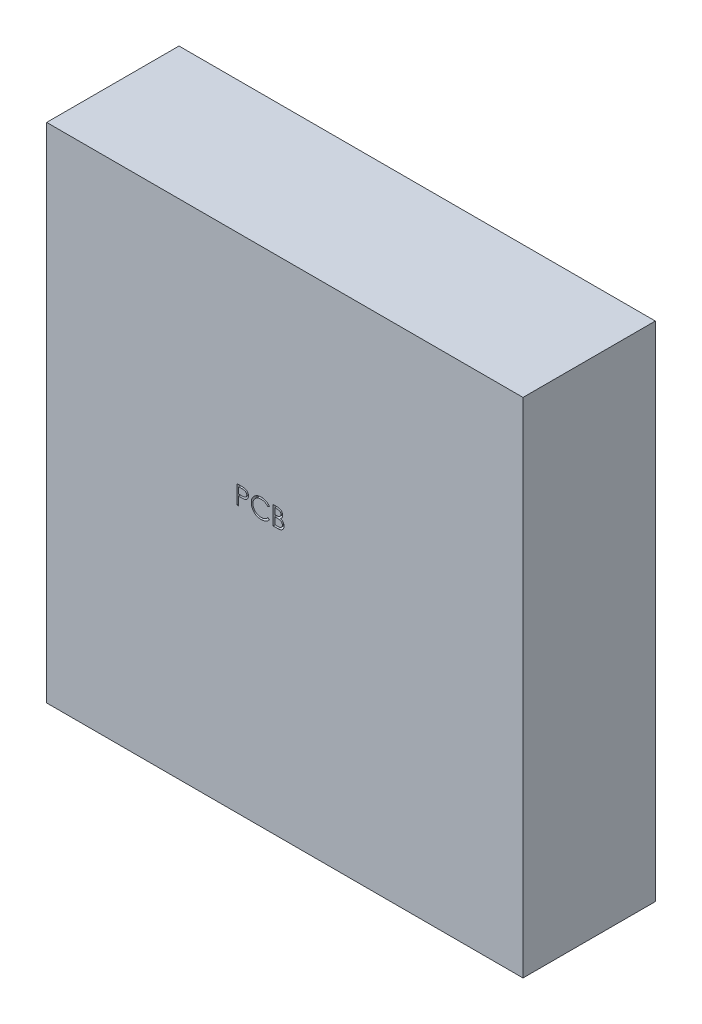
from build123d import *

# Parameters (mm, degrees)
SKETCH1_W           = 90
SKETCH1_H           = 25
BOSS_EXTRUDE1_DEPTH = 95
BOSS_EXTRUDE2_START = -1
BOSS_EXTRUDE2_DEPTH = 1


# Read off the part's stored shape, not the designer's step: Boss-Extrude2
with BuildPart() as part:
    # Sketch1 → Boss-Extrude1 (new body)
    with BuildSketch(Plane(origin=(0, 0, 0), x_dir=(1, 0, 0), z_dir=(0, 1, 0))):
        with Locations((15.273547721, 2.732737108)):
            Rectangle(SKETCH1_W, SKETCH1_H)
    extrude(amount=BOSS_EXTRUDE1_DEPTH)

    # Boss-Extrude2 outline → Boss-Extrude2 (cut)
    # profile 1 of 3: a face of its own
    with BuildSketch(Plane.XY.offset(9.767262892).offset(BOSS_EXTRUDE2_START)):
        with BuildLine():
            add(Edge.make_bspline(
                [(13.74484957, 53.868745646), (13.778278048, 53.868569896), (13.843070759, 53.868229248), (13.9372902, 53.862946117), (14.025539011, 53.855742447), (14.107842783, 53.844312354), (14.184163486, 53.830520577), (14.254731123, 53.813818761), (14.319321295, 53.793792147), (14.396434032, 53.761945866), (14.484354693, 53.714622698), (14.579553085, 53.644694133), (14.660957325, 53.559161669), (14.731143642, 53.462679014), (14.786944761, 53.356543242), (14.827314059, 53.243284053), (14.852871934, 53.124362312), (14.855500368, 53.042719134), (14.856828737, 53.001457986)],
                knots=[0, 0, 0, 0, 0.062594097, 0.121322939, 0.176680142, 0.228365096, 0.276868446, 0.321879128, 0.364098625, 0.403355696, 0.477967948, 0.550535461, 0.623584457, 0.698174882, 0.77335367, 0.847281125, 0.92281834, 1, 1, 1, 1], degree=3))
            Line((13.74484957, 53.868745646), (13.061956942, 53.868745646))
            Line((13.061956942, 53.868745646), (13.061956942, 50.368745646))
            Line((13.061956942, 50.368745646), (14.008471365, 50.368745646))
            add(Edge.make_bspline(
                [(15.126059506, 51.36223523), (15.12508266, 51.328068357), (15.123160688, 51.260844079), (15.108980716, 51.162088945), (15.084971609, 51.067713998), (15.051900463, 50.977108815), (15.008738148, 50.890448681), (14.956210184, 50.807635417), (14.89357862, 50.729501086), (14.823515751, 50.655177463), (14.744253606, 50.588349676), (14.658737851, 50.528833969), (14.565891531, 50.479887907), (14.467239537, 50.438771886), (14.361675221, 50.407364687), (14.249672614, 50.385392113), (14.131328312, 50.370587076), (14.050118561, 50.369369871), (14.008471365, 50.368745646)],
                knots=[0, 0, 0, 0, 0.061160277, 0.120334558, 0.178180255, 0.235235126, 0.292682961, 0.351186248, 0.41045661, 0.471719854, 0.533761203, 0.595739024, 0.657887515, 0.72129518, 0.786822515, 0.854686154, 0.925477986, 1, 1, 1, 1], degree=3))
            add(Edge.make_bspline(
                [(14.452281461, 52.25686664), (14.492041889, 52.241601641), (14.568113436, 52.212395916), (14.672799448, 52.160760452), (14.762994293, 52.104598342), (14.839391439, 52.043266492), (14.904729094, 51.977157681), (14.961782036, 51.905302567), (15.01046341, 51.826763809), (15.052176334, 51.742360274), (15.08472509, 51.652953805), (15.109100994, 51.559383029), (15.123068443, 51.461983474), (15.125056084, 51.395698095), (15.126059506, 51.36223523)],
                knots=[0, 0, 0, 0, 0.106057493, 0.202914257, 0.290300165, 0.370222566, 0.446383721, 0.5213969, 0.598291083, 0.676142469, 0.7555287, 0.834887172, 0.916646049, 1, 1, 1, 1], degree=3))
            add(Edge.make_bspline(
                [(14.856828737, 53.001457986), (14.855735518, 52.96280543), (14.853587241, 52.886849513), (14.833044482, 52.775755404), (14.800883813, 52.670004185), (14.756178564, 52.5699818), (14.698076568, 52.477948187), (14.629218249, 52.393160921), (14.546141447, 52.319209864), (14.483898207, 52.277866961), (14.452281461, 52.25686664)],
                knots=[0, 0, 0, 0, 0.130569107, 0.256580609, 0.380551617, 0.503622917, 0.625739323, 0.747548582, 0.871766119, 1, 1, 1, 1], degree=3))
        make_face()
        with BuildLine():
            add(Edge.make_bspline(
                [(14.239140435, 51.987635871), (14.22211134, 51.991090955), (14.185188747, 51.998582289), (14.124981167, 52.006489993), (14.056245298, 52.013535053), (13.978822421, 52.01874621), (13.89261458, 52.024132754), (13.797437661, 52.026227575), (13.693680346, 52.028726835), (13.621687974, 52.028907969), (13.584292679, 52.029002056)],
                knots=[0, 0, 0, 0, 0.079306486, 0.171952819, 0.277056507, 0.394730576, 0.526177321, 0.671344767, 0.829285257, 1, 1, 1, 1], degree=3))
            add(Edge.make_bspline(
                [(14.811956942, 51.36223523), (14.811680837, 51.38072857), (14.811133082, 51.417416952), (14.802872467, 51.471332771), (14.790858598, 51.523558644), (14.775327164, 51.574236385), (14.752707697, 51.622449761), (14.726301152, 51.669152321), (14.69533975, 51.7144058), (14.647095584, 51.771618054), (14.5769236, 51.837535066), (14.477216824, 51.902072569), (14.363844526, 51.954120376), (14.281617033, 51.976219852), (14.239140435, 51.987635871)],
                knots=[0, 0, 0, 0, 0.060287398, 0.119602355, 0.177503371, 0.235142664, 0.292132593, 0.350871209, 0.410097863, 0.470731522, 0.594828704, 0.722578824, 0.85669139, 1, 1, 1, 1], degree=3))
            add(Edge.make_bspline(
                [(13.823375211, 50.727720005), (13.855394137, 50.728103753), (13.917106396, 50.728843375), (14.006207626, 50.73125793), (14.088790729, 50.736750205), (14.164478865, 50.745396055), (14.234089318, 50.754774504), (14.296787021, 50.767385785), (14.353080214, 50.781834746), (14.418354522, 50.804168918), (14.49185803, 50.838865389), (14.571068887, 50.891179615), (14.641495105, 50.953502923), (14.701300364, 51.025633837), (14.750313353, 51.104065164), (14.785968808, 51.187210514), (14.807959664, 51.273696041), (14.810621834, 51.332662754), (14.811956942, 51.36223523)],
                knots=[0, 0, 0, 0, 0.072502489, 0.139738989, 0.201795135, 0.259821934, 0.312205989, 0.360773434, 0.404540343, 0.443698099, 0.516840794, 0.587874336, 0.657965418, 0.728969389, 0.79930772, 0.866635778, 0.933116329, 1, 1, 1, 1], degree=3))
            Line((13.823375211, 50.727720005), (13.376059506, 50.727720005))
            Line((13.376059506, 50.727720005), (13.376059506, 52.029002056))
            Line((13.376059506, 52.029002056), (13.584292679, 52.029002056))
        make_face(mode=Mode.SUBTRACT)
        with BuildLine():
            add(Edge.make_bspline(
                [(14.542726173, 52.99514789), (14.542199992, 53.014573661), (14.541167833, 53.052679433), (14.53271453, 53.108228788), (14.518346955, 53.16047254), (14.499892662, 53.21012665), (14.474103974, 53.255638501), (14.44374051, 53.298581696), (14.40705482, 53.337493815), (14.365297507, 53.373863313), (14.317288884, 53.406107841), (14.263057593, 53.434348604), (14.201869916, 53.457089381), (14.134757061, 53.477005533), (14.060685973, 53.490993827), (13.98051142, 53.502647215), (13.893576701, 53.508579957), (13.833431598, 53.50936532), (13.802341557, 53.509771287)],
                knots=[0, 0, 0, 0, 0.057003133, 0.111817869, 0.164402372, 0.215869805, 0.26684111, 0.317478963, 0.369902136, 0.423400449, 0.479718398, 0.539241497, 0.602430689, 0.671029546, 0.744484798, 0.823453971, 0.908740313, 1, 1, 1, 1], degree=3))
            add(Edge.make_bspline(
                [(13.587097166, 52.387976415), (13.617945962, 52.388376338), (13.677552121, 52.389149071), (13.763872017, 52.391362588), (13.843997036, 52.397560632), (13.917788869, 52.403756894), (13.985131313, 52.413831481), (14.045875174, 52.425823604), (14.100973771, 52.438506509), (14.164513317, 52.460075996), (14.236586265, 52.491953671), (14.313419369, 52.541425508), (14.381153839, 52.600349861), (14.438351026, 52.668340823), (14.485162497, 52.743207008), (14.517676212, 52.823753889), (14.539723496, 52.907974021), (14.541715028, 52.965792274), (14.542726173, 52.99514789)],
                knots=[0, 0, 0, 0, 0.072301034, 0.139700332, 0.202288511, 0.260599533, 0.313190329, 0.361738933, 0.405706476, 0.445539985, 0.518831956, 0.58977824, 0.658867479, 0.728430478, 0.797282704, 0.864815377, 0.931363753, 1, 1, 1, 1], degree=3))
            Line((13.587097166, 52.387976415), (13.376059506, 52.387976415))
            Line((13.376059506, 52.387976415), (13.376059506, 53.509771287))
            Line((13.376059506, 53.509771287), (13.802341557, 53.509771287))
        make_face(mode=Mode.SUBTRACT)
    # profile 2 of 3: a face of its own
    with BuildSketch(Plane.XY.offset(9.767262892).offset(BOSS_EXTRUDE2_START)):
        with BuildLine():
            add(Edge.make_bspline(
                [(10.816964955, 53.958489236), (10.857179427, 53.958007098), (10.936779924, 53.957052754), (11.054532576, 53.947746612), (11.169174903, 53.932233005), (11.280785885, 53.911116936), (11.389908501, 53.884909614), (11.495708742, 53.850769316), (11.598807429, 53.811732785), (11.698554337, 53.766774319), (11.794470888, 53.716307577), (11.886527206, 53.660891954), (11.973992065, 53.600596148), (12.057480913, 53.535932973), (12.135597124, 53.465534413), (12.210558603, 53.391336817), (12.279819681, 53.311202993), (12.322572876, 53.254798059), (12.344008224, 53.226518082)],
                knots=[0, 0, 0, 0, 0.068547537, 0.135682946, 0.20121499, 0.265682235, 0.329266835, 0.392395428, 0.455069762, 0.51712685, 0.578790035, 0.639739863, 0.700191504, 0.759806243, 0.819628319, 0.879354791, 0.939511608, 1, 1, 1, 1], degree=3))
            add(Edge.make_bspline(
                [(8.933751814, 52.139078178), (8.935307007, 52.202033632), (8.938366753, 52.325894556), (8.964362549, 52.50766851), (9.006181345, 52.681819909), (9.065578234, 52.848023653), (9.140883585, 53.007153933), (9.233910199, 53.157995138), (9.343577341, 53.301511938), (9.469024909, 53.435526689), (9.606592244, 53.558066042), (9.753911058, 53.665872246), (9.910693005, 53.755589762), (10.075210857, 53.830585924), (10.248696538, 53.888230387), (10.430779907, 53.928583574), (10.621118822, 53.95370069), (10.750981248, 53.956875898), (10.816964955, 53.958489236)],
                knots=[0, 0, 0, 0, 0.064557846, 0.127013532, 0.18795481, 0.248013913, 0.307747682, 0.368234515, 0.429469844, 0.492743437, 0.556257769, 0.618216786, 0.679655476, 0.741245546, 0.803415265, 0.866815462, 0.932328312, 1, 1, 1, 1], degree=3))
            add(Edge.make_bspline(
                [(9.37756191, 50.891081383), (9.342126266, 50.934622572), (9.271682789, 51.021179283), (9.181557106, 51.161465264), (9.104409551, 51.307933473), (9.04203363, 51.461353402), (8.993270897, 51.621380789), (8.959489702, 51.788096303), (8.937538097, 51.961344245), (8.935027808, 52.079181034), (8.933751814, 52.139078178)],
                knots=[0, 0, 0, 0, 0.12432851, 0.247156016, 0.368779749, 0.490733862, 0.613613772, 0.738957576, 0.867310575, 1, 1, 1, 1], degree=3))
            add(Edge.make_bspline(
                [(10.821171685, 50.279002056), (10.783528018, 50.279264049), (10.709092328, 50.279782107), (10.599193577, 50.288174274), (10.492203996, 50.299624011), (10.38842937, 50.316864142), (10.287303395, 50.337208482), (10.18974281, 50.364479739), (10.0947876, 50.395028906), (10.002819259, 50.430933892), (9.91375956, 50.471450075), (9.827895748, 50.517241634), (9.745267316, 50.567923498), (9.665061895, 50.622378509), (9.588464311, 50.682355811), (9.514810786, 50.747022445), (9.44368831, 50.816160456), (9.399685625, 50.866015309), (9.37756191, 50.891081383)],
                knots=[0, 0, 0, 0, 0.069662801, 0.137749562, 0.203916744, 0.268779862, 0.332413706, 0.39475354, 0.456180032, 0.516995649, 0.577395938, 0.637198344, 0.696999184, 0.756756194, 0.816553905, 0.876947997, 0.938131788, 1, 1, 1, 1], degree=3))
            add(Edge.make_bspline(
                [(12.344008224, 51.013076576), (12.321890114, 50.984538124), (12.277759839, 50.927597918), (12.206301822, 50.847326208), (12.131024524, 50.771822172), (12.051368814, 50.701694551), (11.968251023, 50.635540085), (11.88017871, 50.575238254), (11.788309678, 50.51994737), (11.692955199, 50.469320445), (11.594216586, 50.424403198), (11.492212151, 50.385949431), (11.387381576, 50.352824541), (11.279720067, 50.325572604), (11.16900431, 50.30430152), (11.055633836, 50.290081846), (10.939363961, 50.280339931), (10.86092254, 50.279452015), (10.821171685, 50.279002056)],
                knots=[0, 0, 0, 0, 0.061674239, 0.123053062, 0.183475001, 0.243726501, 0.304278917, 0.364862921, 0.425946204, 0.48739123, 0.549220384, 0.611143589, 0.67352853, 0.736961457, 0.800785283, 0.866012596, 0.932100748, 1, 1, 1, 1], degree=3))
            Line((12.344008224, 51.013076576), (12.06916848, 51.221309749))
            add(Edge.make_bspline(
                [(10.81906832, 50.637976415), (10.880171009, 50.639665195), (11.000435718, 50.642989118), (11.176803744, 50.671148367), (11.34563951, 50.716806285), (11.506952096, 50.780704207), (11.660286743, 50.863769495), (11.805883403, 50.964467372), (11.943864973, 51.083755705), (12.026836256, 51.174838833), (12.06916848, 51.221309749)],
                knots=[0, 0, 0, 0, 0.12851519, 0.252948636, 0.374754734, 0.495939754, 0.617180641, 0.740909469, 0.867811148, 1, 1, 1, 1], degree=3))
            add(Edge.make_bspline(
                [(9.247854378, 52.115240037), (9.249116197, 52.063508717), (9.251593611, 51.961941132), (9.273641945, 51.813170522), (9.307147036, 51.670649848), (9.357362613, 51.535270006), (9.419281664, 51.405361648), (9.497522275, 51.283122794), (9.588138813, 51.16670623), (9.692413232, 51.058863282), (9.806819048, 50.960349557), (9.92956696, 50.873598975), (10.060351248, 50.801284093), (10.197727878, 50.741108146), (10.342753992, 50.694851419), (10.495168794, 50.662287295), (10.654640789, 50.641045115), (10.763610189, 50.639011427), (10.81906832, 50.637976415)],
                knots=[0, 0, 0, 0, 0.064323217, 0.126290104, 0.186726469, 0.246146432, 0.305575643, 0.365429386, 0.426326309, 0.488839906, 0.551724972, 0.613918596, 0.675483766, 0.737333897, 0.800229044, 0.864502298, 0.931040739, 1, 1, 1, 1], degree=3))
            add(Edge.make_bspline(
                [(10.797333544, 53.599514877), (10.762250245, 53.599110914), (10.692409252, 53.598306739), (10.588760779, 53.587697613), (10.487047728, 53.572786403), (10.387336262, 53.55066108), (10.289753303, 53.522688461), (10.193660901, 53.489263047), (10.100450301, 53.447908207), (10.008832063, 53.402199947), (9.921052852, 53.350572503), (9.837997804, 53.294259151), (9.759969836, 53.233890054), (9.686907224, 53.169238948), (9.618735276, 53.100596987), (9.555947965, 53.027232646), (9.498762555, 52.949380472), (9.44604553, 52.868067065), (9.398832796, 52.783529273), (9.359302917, 52.695454203), (9.324297795, 52.6053501), (9.296598552, 52.512198939), (9.274674035, 52.416656173), (9.259546372, 52.318465385), (9.249057901, 52.217831705), (9.248257724, 52.149622393), (9.247854378, 52.115240037)],
                knots=[0, 0, 0, 0, 0.043954909, 0.087501875, 0.130462627, 0.172752021, 0.215403067, 0.25764983, 0.300152749, 0.34312149, 0.385925163, 0.427685727, 0.46881795, 0.5094918, 0.549883031, 0.589980023, 0.63040523, 0.670868626, 0.711383944, 0.751627258, 0.791775577, 0.832458919, 0.873319045, 0.914542956, 0.956923558, 1, 1, 1, 1], degree=3))
            add(Edge.make_bspline(
                [(12.06916848, 53.016181544), (12.049562592, 53.039547513), (12.010615145, 53.085964429), (11.947955943, 53.151143974), (11.8826543, 53.212209235), (11.814735178, 53.269451115), (11.742976059, 53.32086788), (11.66911526, 53.369138983), (11.591917215, 53.412406721), (11.48516548, 53.464869707), (11.345517632, 53.519615862), (11.169722793, 53.565519094), (10.986211695, 53.594740269), (10.861014095, 53.597905111), (10.797333544, 53.599514877)],
                knots=[0, 0, 0, 0, 0.063163259, 0.125474941, 0.18712122, 0.248294346, 0.309294856, 0.369850066, 0.430973376, 0.49245599, 0.616147966, 0.740843698, 0.868182649, 1, 1, 1, 1], degree=3))
            Line((12.06916848, 53.016181544), (12.344008224, 53.226518082))
        make_face()
    # profile 3 of 3: a face of its own
    with BuildSketch(Plane.XY.offset(9.767262892).offset(BOSS_EXTRUDE2_START)):
        with BuildLine():
            add(Edge.make_bspline(
                [(6.927842358, 53.868745646), (6.975053265, 53.86869375), (7.065511457, 53.868594314), (7.195226513, 53.865579569), (7.313036245, 53.861552877), (7.418686626, 53.855970983), (7.512502724, 53.849374393), (7.594060023, 53.840122354), (7.66399958, 53.830462058), (7.705906029, 53.820640652), (7.725017839, 53.816161512)],
                knots=[0, 0, 0, 0, 0.176955752, 0.33905508, 0.486318225, 0.618780923, 0.735618828, 0.838742477, 0.926457068, 1, 1, 1, 1], degree=3))
            Line((6.927842358, 53.868745646), (6.241444121, 53.868745646))
            Line((6.241444121, 53.868745646), (6.241444121, 50.368745646))
            Line((6.241444121, 50.368745646), (6.555546685, 50.368745646))
            Line((6.555546685, 50.368745646), (6.555546685, 51.984130262))
            Line((6.555546685, 51.984130262), (6.805847166, 51.984130262))
            add(Edge.make_bspline(
                [(7.696972967, 52.041622249), (7.675045633, 52.036959268), (7.626990606, 52.026740074), (7.547847884, 52.015331617), (7.455702498, 52.005594016), (7.350680218, 51.998292878), (7.232875313, 51.99204251), (7.102224056, 51.987074416), (6.958469979, 51.984344562), (6.858198735, 51.984203769), (6.805847166, 51.984130262)],
                knots=[0, 0, 0, 0, 0.075173117, 0.164746258, 0.268016881, 0.385911876, 0.517789479, 0.663690977, 0.824413221, 1, 1, 1, 1], degree=3))
            add(Edge.make_bspline(
                [(8.395290275, 52.929943563), (8.39486885, 52.901165786), (8.394044304, 52.844860122), (8.384148019, 52.762487334), (8.370817828, 52.683768944), (8.350320775, 52.608879493), (8.323475102, 52.538263723), (8.291983049, 52.470842491), (8.253999519, 52.407762819), (8.210354689, 52.348795701), (8.161803095, 52.293885789), (8.108550157, 52.243430995), (8.050810864, 52.197726656), (7.988768716, 52.156670313), (7.921818867, 52.121214033), (7.850976714, 52.089456728), (7.775626497, 52.062785667), (7.723483983, 52.048755606), (7.696972967, 52.041622249)],
                knots=[0, 0, 0, 0, 0.070118894, 0.137192353, 0.202016181, 0.264631407, 0.326116547, 0.386010305, 0.445811847, 0.505297697, 0.564633278, 0.624282625, 0.683902032, 0.743952771, 0.805387731, 0.868388031, 0.933084028, 1, 1, 1, 1], degree=3))
            add(Edge.make_bspline(
                [(7.725017839, 53.816161512), (7.749211373, 53.809539562), (7.79702835, 53.7964517), (7.865929393, 53.770237977), (7.931483239, 53.739155811), (7.993914797, 53.703731872), (8.05245688, 53.662446307), (8.107982921, 53.61697269), (8.160002902, 53.566261121), (8.208224293, 53.510880381), (8.252509091, 53.451760171), (8.290638774, 53.388017941), (8.322566001, 53.320726638), (8.349949272, 53.249933067), (8.369657727, 53.175042743), (8.384504626, 53.096576031), (8.393928254, 53.014541341), (8.394830816, 52.958481473), (8.395290275, 52.929943563)],
                knots=[0, 0, 0, 0, 0.062481339, 0.123490383, 0.183411094, 0.243153221, 0.302126735, 0.361709671, 0.421842292, 0.482931901, 0.544552254, 0.60568072, 0.667679738, 0.729984388, 0.794550921, 0.86034562, 0.928907356, 1, 1, 1, 1], degree=3))
        make_face()
        with BuildLine():
            add(Edge.make_bspline(
                [(8.081187711, 52.928541319), (8.079925065, 52.956679833), (8.07741508, 53.012615715), (8.058759216, 53.094594476), (8.027409903, 53.17283018), (7.983953308, 53.245803265), (7.931212178, 53.311992069), (7.869912835, 53.369489196), (7.800199574, 53.415710899), (7.735351343, 53.445544181), (7.677750157, 53.463759456), (7.627718197, 53.476504297), (7.571227522, 53.486679903), (7.508259743, 53.494919406), (7.439302909, 53.501972867), (7.363764594, 53.506758844), (7.281930951, 53.5095603), (7.22512038, 53.509699256), (7.195670884, 53.509771287)],
                knots=[0, 0, 0, 0, 0.070043755, 0.139238317, 0.208197455, 0.279173374, 0.349986812, 0.418353846, 0.487609584, 0.557411073, 0.595330157, 0.637964052, 0.685912778, 0.738185165, 0.796102647, 0.858516544, 0.926657726, 1, 1, 1, 1], degree=3))
            add(Edge.make_bspline(
                [(7.168327134, 52.335392281), (7.19824706, 52.335376817), (7.25600686, 52.335346965), (7.339443083, 52.339332189), (7.41685237, 52.343932721), (7.487996946, 52.350668645), (7.55290888, 52.360189902), (7.611696409, 52.36980164), (7.663903692, 52.383707003), (7.725002894, 52.402430072), (7.793086241, 52.434362688), (7.86715379, 52.480712578), (7.929924376, 52.539793286), (7.984242673, 52.606221117), (8.027348551, 52.680120247), (8.058904543, 52.759189183), (8.077445701, 52.842617033), (8.079931894, 52.899705172), (8.081187711, 52.928541319)],
                knots=[0, 0, 0, 0, 0.072538371, 0.140033831, 0.202495681, 0.260575056, 0.313228338, 0.361583194, 0.404878361, 0.444127437, 0.516399693, 0.586506671, 0.655085374, 0.724383783, 0.793973529, 0.861637682, 0.930110942, 1, 1, 1, 1], degree=3))
            Line((7.168327134, 52.335392281), (6.555546685, 52.343104621))
            Line((6.555546685, 52.343104621), (6.555546685, 53.509771287))
            Line((6.555546685, 53.509771287), (7.195670884, 53.509771287))
        make_face(mode=Mode.SUBTRACT)
    extrude(amount=BOSS_EXTRUDE2_DEPTH, mode=Mode.SUBTRACT)


solid = part.part
